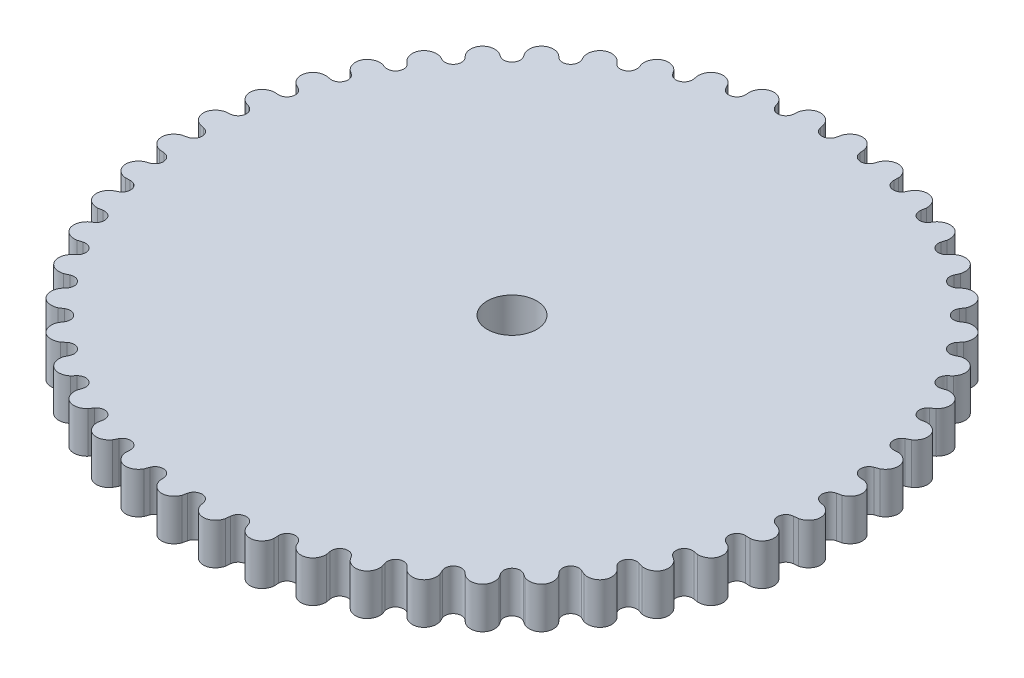
from build123d import *

# Parameters (mm, degrees)
BOSS_EXTRUDE2_DEPTH = 5
SKETCH4_R           = 6
CUT_EXTRUDE3_DEPTH  = 10
CUT_EXTRUDE4_DEPTH  = 10
CIRPATTERN4_COUNT   = 48


with BuildPart() as part:
    # Sketch2 → Boss-Extrude2 (new, symmetric)
    with BuildSketch(Plane(origin=(0, 0, 0), x_dir=(1, 0, 0), z_dir=(0, 1, 0))):
        with BuildLine():
            Line((1.952478146, 76.654930294), (2.684980769, 79.954930294))
            ThreePointArc((2.684980769, 79.954930294), (5.232250338, 79.828713859), (7.774202214, 79.621365097))
            Line((7.774202214, 79.621365097), (8.069701741, 76.253986276))
            ThreePointArc((8.069701741, 76.253986276), (9.800992859, 74.445931817), (11.941250591, 75.744287201))
            Line((11.941250591, 75.744287201), (13.098222987, 78.920444465))
            ThreePointArc((13.098222987, 78.920444465), (15.607225761, 78.462822432), (18.100366442, 77.925456269))
            Line((18.100366442, 77.925456269), (17.953806794, 74.548315412))
            ThreePointArc((17.953806794, 74.548315412), (19.434288013, 72.529750272), (21.725704928, 73.537638354))
            Line((21.725704928, 73.537638354), (23.287350978, 76.535607951))
            ThreePointArc((23.287350978, 76.535607951), (25.715157224, 75.75441036), (28.116828381, 74.896221278))
            Line((28.116828381, 74.896221278), (27.530717236, 71.567102203))
            ThreePointArc((27.530717236, 71.567102203), (28.73505711, 69.372564592), (31.138426429, 70.072740126))
            Line((31.138426429, 70.072740126), (33.078025937, 72.841225965))
            ThreePointArc((33.078025937, 72.841225965), (35.383095218, 71.749819323), (37.652203592, 70.585491177))
            Line((37.652203592, 70.585491177), (36.636569472, 67.361356033))
            ThreePointArc((36.636569472, 67.361356033), (37.544161414, 65.028395097), (40.018360822, 65.408877887))
            Line((40.018360822, 65.408877887), (42.302726702, 67.900510407))
            ThreePointArc((42.302726702, 67.900510407), (44.445618642, 66.517568984), (46.54333916, 65.067023751))
            Line((46.54333916, 65.067023751), (45.115559847, 62.003038385))
            ThreePointArc((45.115559847, 62.003038385), (45.710874707, 59.571571733), (48.213569965, 59.625851612))
            Line((48.213569965, 59.625851612), (50.803616084, 61.797998291))
            ThreePointArc((50.803616084, 61.797998291), (52.747665208, 60.147184598), (54.638105291, 58.435241509))
            Line((54.638105291, 58.435241509), (52.822610485, 55.583831559))
            ThreePointArc((52.822610485, 55.583831559), (53.09546226, 53.09546226), (55.583831559, 52.822610485))
            Line((55.583831559, 52.822610485), (58.435241509, 54.638105291))
            ThreePointArc((58.435241509, 54.638105291), (60.147184598, 52.747665208), (61.797998291, 50.803616084))
            Line((61.797998291, 50.803616084), (59.625851612, 48.213569965))
            ThreePointArc((59.625851612, 48.213569965), (59.571571733, 45.710874707), (62.003038385, 45.115559847))
            Line((62.003038385, 45.115559847), (65.067023751, 46.54333916))
            ThreePointArc((65.067023751, 46.54333916), (66.517568984, 44.445618642), (67.900510407, 42.302726702))
            Line((67.900510407, 42.302726702), (65.408877887, 40.018360822))
            ThreePointArc((65.408877887, 40.018360822), (65.028395097, 37.544161414), (67.361356033, 36.636569472))
            Line((67.361356033, 36.636569472), (70.585491177, 37.652203592))
            ThreePointArc((70.585491177, 37.652203592), (71.749819323, 35.383095218), (72.841225965, 33.078025937))
            Line((72.841225965, 33.078025937), (70.072740126, 31.138426429))
            ThreePointArc((70.072740126, 31.138426429), (69.372564592, 28.73505711), (71.567102203, 27.530717236))
            Line((71.567102203, 27.530717236), (74.896221278, 28.116828381))
            ThreePointArc((74.896221278, 28.116828381), (75.75441036, 25.715157224), (76.535607951, 23.287350978))
            Line((76.535607951, 23.287350978), (73.537638354, 21.725704928))
            ThreePointArc((73.537638354, 21.725704928), (72.529750272, 19.434288013), (74.548315412, 17.953806794))
            Line((74.548315412, 17.953806794), (77.925456269, 18.100366442))
            ThreePointArc((77.925456269, 18.100366442), (78.462822432, 15.607225761), (78.920444465, 13.098222987))
            Line((78.920444465, 13.098222987), (75.744287201, 11.941250591))
            ThreePointArc((75.744287201, 11.941250591), (74.445931817, 9.800992859), (76.253986276, 8.069701741))
            Line((76.253986276, 8.069701741), (79.621365097, 7.774202214))
            ThreePointArc((79.621365097, 7.774202214), (79.828713859, 5.232250338), (79.954930294, 2.684980769))
            Line((79.954930294, 2.684980769), (76.654930294, 1.952478146))
            ThreePointArc((76.654930294, 1.952478146), (75.088322828, 0), (76.654930294, -1.952478146))
            Line((76.654930294, -1.952478146), (79.954930294, -2.684980769))
            ThreePointArc((79.954930294, -2.684980769), (79.828713859, -5.232250338), (79.621365097, -7.774202214))
            Line((79.621365097, -7.774202214), (76.253986276, -8.069701741))
            ThreePointArc((76.253986276, -8.069701741), (74.445931817, -9.800992859), (75.744287201, -11.941250591))
            Line((75.744287201, -11.941250591), (78.920444465, -13.098222987))
            ThreePointArc((78.920444465, -13.098222987), (78.462822432, -15.607225761), (77.925456269, -18.100366442))
            Line((77.925456269, -18.100366442), (74.548315412, -17.953806794))
            ThreePointArc((74.548315412, -17.953806794), (72.529750272, -19.434288013), (73.537638354, -21.725704928))
            Line((73.537638354, -21.725704928), (76.535607951, -23.287350978))
            ThreePointArc((76.535607951, -23.287350978), (75.75441036, -25.715157224), (74.896221278, -28.116828381))
            Line((74.896221278, -28.116828381), (71.567102203, -27.530717236))
            ThreePointArc((71.567102203, -27.530717236), (69.372564592, -28.73505711), (70.072740126, -31.138426429))
            Line((70.072740126, -31.138426429), (72.841225965, -33.078025937))
            ThreePointArc((72.841225965, -33.078025937), (71.749819323, -35.383095218), (70.585491177, -37.652203592))
            Line((70.585491177, -37.652203592), (67.361356033, -36.636569472))
            ThreePointArc((67.361356033, -36.636569472), (65.028395097, -37.544161414), (65.408877887, -40.018360822))
            Line((65.408877887, -40.018360822), (67.900510407, -42.302726702))
            ThreePointArc((67.900510407, -42.302726702), (66.517568984, -44.445618642), (65.067023751, -46.54333916))
            Line((65.067023751, -46.54333916), (62.003038385, -45.115559847))
            ThreePointArc((62.003038385, -45.115559847), (59.571571733, -45.710874707), (59.625851612, -48.213569965))
            Line((59.625851612, -48.213569965), (61.797998291, -50.803616084))
            ThreePointArc((61.797998291, -50.803616084), (60.147184598, -52.747665208), (58.435241509, -54.638105291))
            Line((58.435241509, -54.638105291), (55.583831559, -52.822610485))
            ThreePointArc((55.583831559, -52.822610485), (53.09546226, -53.09546226), (52.822610485, -55.583831559))
            Line((52.822610485, -55.583831559), (54.638105291, -58.435241509))
            ThreePointArc((54.638105291, -58.435241509), (52.747665208, -60.147184598), (50.803616084, -61.797998291))
            Line((50.803616084, -61.797998291), (48.213569965, -59.625851612))
            ThreePointArc((48.213569965, -59.625851612), (45.710874707, -59.571571733), (45.115559847, -62.003038385))
            Line((45.115559847, -62.003038385), (46.54333916, -65.067023751))
            ThreePointArc((46.54333916, -65.067023751), (44.445618642, -66.517568984), (42.302726702, -67.900510407))
            Line((42.302726702, -67.900510407), (40.018360822, -65.408877887))
            ThreePointArc((40.018360822, -65.408877887), (37.544161414, -65.028395097), (36.636569472, -67.361356033))
            Line((36.636569472, -67.361356033), (37.652203592, -70.585491177))
            ThreePointArc((37.652203592, -70.585491177), (35.383095218, -71.749819323), (33.078025937, -72.841225965))
            Line((33.078025937, -72.841225965), (31.138426429, -70.072740126))
            ThreePointArc((31.138426429, -70.072740126), (28.73505711, -69.372564592), (27.530717236, -71.567102203))
            Line((27.530717236, -71.567102203), (28.116828381, -74.896221278))
            ThreePointArc((28.116828381, -74.896221278), (25.715157224, -75.75441036), (23.287350978, -76.535607951))
            Line((23.287350978, -76.535607951), (21.725704928, -73.537638354))
            ThreePointArc((21.725704928, -73.537638354), (19.434288013, -72.529750272), (17.953806794, -74.548315412))
            Line((17.953806794, -74.548315412), (18.100366442, -77.925456269))
            ThreePointArc((18.100366442, -77.925456269), (15.607225761, -78.462822432), (13.098222987, -78.920444465))
            Line((13.098222987, -78.920444465), (11.941250591, -75.744287201))
            ThreePointArc((11.941250591, -75.744287201), (9.800992859, -74.445931817), (8.069701741, -76.253986276))
            Line((8.069701741, -76.253986276), (7.774202214, -79.621365097))
            ThreePointArc((7.774202214, -79.621365097), (5.232250338, -79.828713859), (2.684980769, -79.954930294))
            Line((2.684980769, -79.954930294), (1.952478146, -76.654930294))
            ThreePointArc((1.952478146, -76.654930294), (0, -75.088322828), (-1.952478146, -76.654930294))
            Line((-1.952478146, -76.654930294), (-2.684980769, -79.954930294))
            ThreePointArc((-2.684980769, -79.954930294), (-5.232250338, -79.828713859), (-7.774202214, -79.621365097))
            Line((-7.774202214, -79.621365097), (-8.069701741, -76.253986276))
            ThreePointArc((-8.069701741, -76.253986276), (-9.800992859, -74.445931817), (-11.941250591, -75.744287201))
            Line((-11.941250591, -75.744287201), (-13.098222987, -78.920444465))
            ThreePointArc((-13.098222987, -78.920444465), (-15.607225761, -78.462822432), (-18.100366442, -77.925456269))
            Line((-18.100366442, -77.925456269), (-17.953806794, -74.548315412))
            ThreePointArc((-17.953806794, -74.548315412), (-19.434288013, -72.529750272), (-21.725704928, -73.537638354))
            Line((-21.725704928, -73.537638354), (-23.287350978, -76.535607951))
            ThreePointArc((-23.287350978, -76.535607951), (-25.715157224, -75.75441036), (-28.116828381, -74.896221278))
            Line((-28.116828381, -74.896221278), (-27.530717236, -71.567102203))
            ThreePointArc((-27.530717236, -71.567102203), (-28.73505711, -69.372564592), (-31.138426429, -70.072740126))
            Line((-31.138426429, -70.072740126), (-33.078025937, -72.841225965))
            ThreePointArc((-33.078025937, -72.841225965), (-35.383095218, -71.749819323), (-37.652203592, -70.585491177))
            Line((-37.652203592, -70.585491177), (-36.636569472, -67.361356033))
            ThreePointArc((-36.636569472, -67.361356033), (-37.544161414, -65.028395097), (-40.018360822, -65.408877887))
            Line((-40.018360822, -65.408877887), (-42.302726702, -67.900510407))
            ThreePointArc((-42.302726702, -67.900510407), (-44.445618642, -66.517568984), (-46.54333916, -65.067023751))
            Line((-46.54333916, -65.067023751), (-45.115559847, -62.003038385))
            ThreePointArc((-45.115559847, -62.003038385), (-45.710874707, -59.571571733), (-48.213569965, -59.625851612))
            Line((-48.213569965, -59.625851612), (-50.803616084, -61.797998291))
            ThreePointArc((-50.803616084, -61.797998291), (-52.747665208, -60.147184598), (-54.638105291, -58.435241509))
            Line((-54.638105291, -58.435241509), (-52.822610485, -55.583831559))
            ThreePointArc((-52.822610485, -55.583831559), (-53.09546226, -53.09546226), (-55.583831559, -52.822610485))
            Line((-55.583831559, -52.822610485), (-58.435241509, -54.638105291))
            ThreePointArc((-58.435241509, -54.638105291), (-60.147184598, -52.747665208), (-61.797998291, -50.803616084))
            Line((-61.797998291, -50.803616084), (-59.625851612, -48.213569965))
            ThreePointArc((-59.625851612, -48.213569965), (-59.571571733, -45.710874707), (-62.003038385, -45.115559847))
            Line((-62.003038385, -45.115559847), (-65.067023751, -46.54333916))
            ThreePointArc((-65.067023751, -46.54333916), (-66.517568984, -44.445618642), (-67.900510407, -42.302726702))
            Line((-67.900510407, -42.302726702), (-65.408877887, -40.018360822))
            ThreePointArc((-65.408877887, -40.018360822), (-65.028395097, -37.544161414), (-67.361356033, -36.636569472))
            Line((-67.361356033, -36.636569472), (-70.585491177, -37.652203592))
            ThreePointArc((-70.585491177, -37.652203592), (-71.749819323, -35.383095218), (-72.841225965, -33.078025937))
            Line((-72.841225965, -33.078025937), (-70.072740126, -31.138426429))
            ThreePointArc((-70.072740126, -31.138426429), (-69.372564592, -28.73505711), (-71.567102203, -27.530717236))
            Line((-71.567102203, -27.530717236), (-74.896221278, -28.116828381))
            ThreePointArc((-74.896221278, -28.116828381), (-75.75441036, -25.715157224), (-76.535607951, -23.287350978))
            Line((-76.535607951, -23.287350978), (-73.537638354, -21.725704928))
            ThreePointArc((-73.537638354, -21.725704928), (-72.529750272, -19.434288013), (-74.548315412, -17.953806794))
            Line((-74.548315412, -17.953806794), (-77.925456269, -18.100366442))
            ThreePointArc((-77.925456269, -18.100366442), (-78.462822432, -15.607225761), (-78.920444465, -13.098222987))
            Line((-78.920444465, -13.098222987), (-75.744287201, -11.941250591))
            ThreePointArc((-75.744287201, -11.941250591), (-74.445931817, -9.800992859), (-76.253986276, -8.069701741))
            Line((-76.253986276, -8.069701741), (-79.621365097, -7.774202214))
            ThreePointArc((-79.621365097, -7.774202214), (-79.828713859, -5.232250338), (-79.954930294, -2.684980769))
            Line((-79.954930294, -2.684980769), (-76.654930294, -1.952478146))
            ThreePointArc((-76.654930294, -1.952478146), (-75.088322828, 0), (-76.654930294, 1.952478146))
            Line((-76.654930294, 1.952478146), (-79.954930294, 2.684980769))
            ThreePointArc((-79.954930294, 2.684980769), (-79.828713859, 5.232250338), (-79.621365097, 7.774202214))
            Line((-79.621365097, 7.774202214), (-76.253986276, 8.069701741))
            ThreePointArc((-76.253986276, 8.069701741), (-74.445931817, 9.800992859), (-75.744287201, 11.941250591))
            Line((-75.744287201, 11.941250591), (-78.920444465, 13.098222987))
            ThreePointArc((-78.920444465, 13.098222987), (-78.462822432, 15.607225761), (-77.925456269, 18.100366442))
            Line((-77.925456269, 18.100366442), (-74.548315412, 17.953806794))
            ThreePointArc((-74.548315412, 17.953806794), (-72.529750272, 19.434288013), (-73.537638354, 21.725704928))
            Line((-73.537638354, 21.725704928), (-76.535607951, 23.287350978))
            ThreePointArc((-76.535607951, 23.287350978), (-75.75441036, 25.715157224), (-74.896221278, 28.116828381))
            Line((-74.896221278, 28.116828381), (-71.567102203, 27.530717236))
            ThreePointArc((-71.567102203, 27.530717236), (-69.372564592, 28.73505711), (-70.072740126, 31.138426429))
            Line((-70.072740126, 31.138426429), (-72.841225965, 33.078025937))
            ThreePointArc((-72.841225965, 33.078025937), (-71.749819323, 35.383095218), (-70.585491177, 37.652203592))
            Line((-70.585491177, 37.652203592), (-67.361356033, 36.636569472))
            ThreePointArc((-67.361356033, 36.636569472), (-65.028395097, 37.544161414), (-65.408877887, 40.018360822))
            Line((-65.408877887, 40.018360822), (-67.900510407, 42.302726702))
            ThreePointArc((-67.900510407, 42.302726702), (-66.517568984, 44.445618642), (-65.067023751, 46.54333916))
            Line((-65.067023751, 46.54333916), (-62.003038385, 45.115559847))
            ThreePointArc((-62.003038385, 45.115559847), (-59.571571733, 45.710874707), (-59.625851612, 48.213569965))
            Line((-59.625851612, 48.213569965), (-61.797998291, 50.803616084))
            ThreePointArc((-61.797998291, 50.803616084), (-60.147184598, 52.747665208), (-58.435241509, 54.638105291))
            Line((-58.435241509, 54.638105291), (-55.583831559, 52.822610485))
            ThreePointArc((-55.583831559, 52.822610485), (-53.09546226, 53.09546226), (-52.822610485, 55.583831559))
            Line((-52.822610485, 55.583831559), (-54.638105291, 58.435241509))
            ThreePointArc((-54.638105291, 58.435241509), (-52.747665208, 60.147184598), (-50.803616084, 61.797998291))
            Line((-50.803616084, 61.797998291), (-48.213569965, 59.625851612))
            ThreePointArc((-48.213569965, 59.625851612), (-45.710874707, 59.571571733), (-45.115559847, 62.003038385))
            Line((-45.115559847, 62.003038385), (-46.54333916, 65.067023751))
            ThreePointArc((-46.54333916, 65.067023751), (-44.445618642, 66.517568984), (-42.302726702, 67.900510407))
            Line((-42.302726702, 67.900510407), (-40.018360822, 65.408877887))
            ThreePointArc((-40.018360822, 65.408877887), (-37.544161414, 65.028395097), (-36.636569472, 67.361356033))
            Line((-36.636569472, 67.361356033), (-37.652203592, 70.585491177))
            ThreePointArc((-37.652203592, 70.585491177), (-35.383095218, 71.749819323), (-33.078025937, 72.841225965))
            Line((-33.078025937, 72.841225965), (-31.138426429, 70.072740126))
            ThreePointArc((-31.138426429, 70.072740126), (-28.73505711, 69.372564592), (-27.530717236, 71.567102203))
            Line((-27.530717236, 71.567102203), (-28.116828381, 74.896221278))
            ThreePointArc((-28.116828381, 74.896221278), (-25.715157224, 75.75441036), (-23.287350978, 76.535607951))
            Line((-23.287350978, 76.535607951), (-21.725704928, 73.537638354))
            ThreePointArc((-21.725704928, 73.537638354), (-19.434288013, 72.529750272), (-17.953806794, 74.548315412))
            Line((-17.953806794, 74.548315412), (-18.100366442, 77.925456269))
            ThreePointArc((-18.100366442, 77.925456269), (-15.607225761, 78.462822432), (-13.098222987, 78.920444465))
            Line((-13.098222987, 78.920444465), (-11.941250591, 75.744287201))
            ThreePointArc((-11.941250591, 75.744287201), (-9.800992859, 74.445931817), (-8.069701741, 76.253986276))
            Line((-8.069701741, 76.253986276), (-7.774202214, 79.621365097))
            ThreePointArc((-7.774202214, 79.621365097), (-5.232250338, 79.828713859), (-2.684980769, 79.954930294))
            Line((-2.684980769, 79.954930294), (-1.952478146, 76.654930294))
            ThreePointArc((-1.952478146, 76.654930294), (0, 75.088322828), (1.952478146, 76.654930294))
        make_face()
    extrude(amount=BOSS_EXTRUDE2_DEPTH, both=True)

    # Sketch4 → Cut-Extrude3 (cut)
    with BuildSketch(Plane(origin=(0, 5, 0), x_dir=(1, 0, 0), z_dir=(0, 1, 0))):
        Circle(SKETCH4_R)
    extrude(amount=-CUT_EXTRUDE3_DEPTH, mode=Mode.SUBTRACT)

    # Sketch7 → Cut-Extrude4 (cut)
    with BuildSketch(Plane(origin=(0, 5, 0), x_dir=(1, 0, 0), z_dir=(0, 1, 0))):
        with BuildLine():
            ThreePointArc((8.069701741, 76.253986276), (5.354803366, 81.698511729), (1.952478146, 76.654930294))
            add(Edge.make_bspline(
                [(8.069701741, 76.253986276), (8.290862136, 79.62824185), (5.232250338, 79.828713859), (2.173638541, 80.029185868), (1.952478146, 76.654930294)],
                knots=[1.570796327, 1.570796327, 1.570796327, 3.141592654, 3.141592654, 4.71238898, 4.71238898, 4.71238898], degree=2, weights=[1, 0.707106781, 1, 0.707106781, 1]))
        make_face()
    cut_extrude4 = extrude(amount=-CUT_EXTRUDE4_DEPTH, mode=Mode.SUBTRACT)

    # CirPattern4: Cut-Extrude4 ×48 about axis
    cirpattern4_axis = Axis((0, 5, 0), (0, 1, 0))
    for i in range(1, CIRPATTERN4_COUNT):
        add(cut_extrude4.rotate(cirpattern4_axis, i * 360 / CIRPATTERN4_COUNT), mode=Mode.SUBTRACT)


solid = part.part
